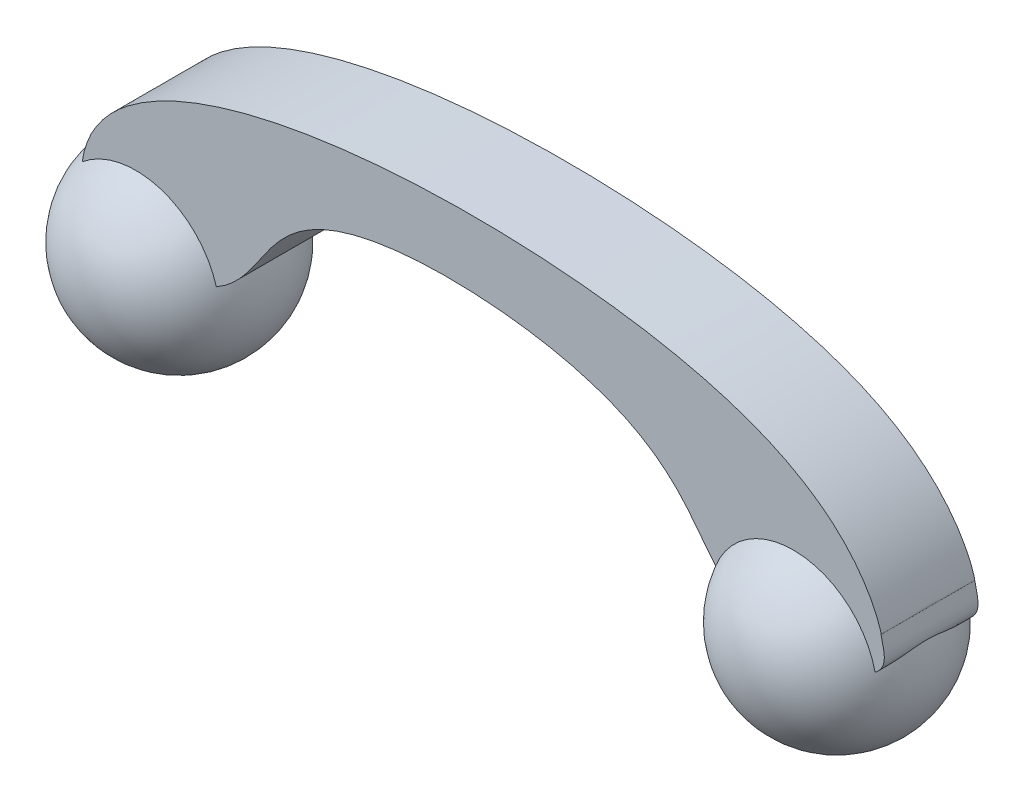
from build123d import *

# Parameters (mm, degrees)
BOSS_EXTRUDE1_DEPTH = 20


# Read off the part's stored shape, not the designer's step: Boss-Extrude1
with BuildPart() as part:
    # Boss-Extrude1 outline → Boss-Extrude1 (new body)
    with BuildSketch(Plane.XY):
        with BuildLine():
            add(Edge.make_bspline(
                [(88.876710402, -2.002586822), (88.9493666131852, -1.9299306111192516), (88.4625699978628, 0.4568259281849222), (87.07101235202, 4.161910300422061), (84.73052634724378, 8.45500011557144), (81.46452093002502, 12.839206368183609), (77.24103186625386, 17.00911709970944), (71.93195290896183, 20.803795803023178), (65.32925222978359, 24.158999559971143), (57.19621791696868, 27.06225253428082), (47.335015505133114, 29.51378107366912), (35.65507966429881, 31.49568730649157), (22.23010133812801, 32.95110874977801), (7.334610783619065, 33.77448207700359), (-8.545603873112306, 33.81339982544799), (-24.73176378798255, 32.88191945449804), (-40.39833431767832, 30.78455479775411), (-54.643270604282016, 27.349550583302506), (-66.57507756172521, 22.469411328020367), (-75.406248837651, 16.14602654328372), (-80.53941016190787, 8.537104820951011), (-83.39672891288393, -13.84522539502793), (-61.221940715805076, -15.925333234293028), (-49.587864737730854, -13.445940213401869), (-35.47439605280903, -11.347992129221693), (-35.474395138973044, 2.574753359034609), (-37.57234303482898, 13.63666157313359), (-90.59320738468432, 42.62648764825083), (6.865999341566411, 15.353169169956265), (21.55164652021018, 15.353165638104155), (23.649596419713923, 18.023280969032704), (59.69615314335737, 30.61096775758453), (54.355929072849776, 3.719095036640508), (59.696158438048975, -5.054145848334971), (52.257981621563104, -14.0181057250969), (13.350588262830351, -27.17796082242287), (84.68079572840632, -13.636666154662072), (87.92309673716264, -13.636662647508883), (91.16538011136153, -12.110882655992413), (91.16538105607023, -9.440767269492538), (89.0674336356561, -3.528369172562094), (88.876710402, -2.002586822)],
                knots=[0, 0, 0, 0, 0, 0, 0, 0, 0, 0, 0, 0, 0, 0, 0, 0, 0, 0, 0, 0, 0, 0, 1, 1, 1, 1, 1, 1, 1, 1, 1, 1, 1, 1, 1, 1, 1, 1, 1, 1, 1, 1, 2.62177057508421, 2.62177057508421, 2.62177057508421, 2.62177057508421, 2.62177057508421, 2.62177057508421, 2.62177057508421, 2.62177057508421, 2.62177057508421, 2.62177057508421, 2.62177057508421, 2.62177057508421, 2.62177057508421, 2.62177057508421, 2.62177057508421, 2.62177057508421, 2.62177057508421, 2.62177057508421, 2.62177057508421, 2.62177057508421, 2.62177057508421, 2.62177057508421], degree=21))
        make_face()
    extrude(amount=BOSS_EXTRUDE1_DEPTH)

    # Sketch7 → Revolve4 (revolve)
    with BuildSketch(Plane(origin=(2.6990032539533013, -13.65, 1.73e-15), x_dir=(1, 0, 0), z_dir=(0, 1, 0))):
        with BuildLine():
            Line((67.48143473107149, -30.87020769655964), (67.48143473107149, 9.44190425666576))
            ThreePointArc((67.48143473107149, 9.44190425666576), (47.32537875445879, -10.714151719946939), (67.48143473107149, -30.87020769655964))
        make_face()
    revolve4 = revolve(axis=Axis((70.1804379850248, -13.65, 30.87020769655964), (0, 0, -1)))

    # Mirror1: Revolve4 across plane
    add(revolve4.mirror(Plane(origin=(0, 0, 0), x_dir=(0, 0, 1), z_dir=(1, 0, 0))))


solid = part.part
